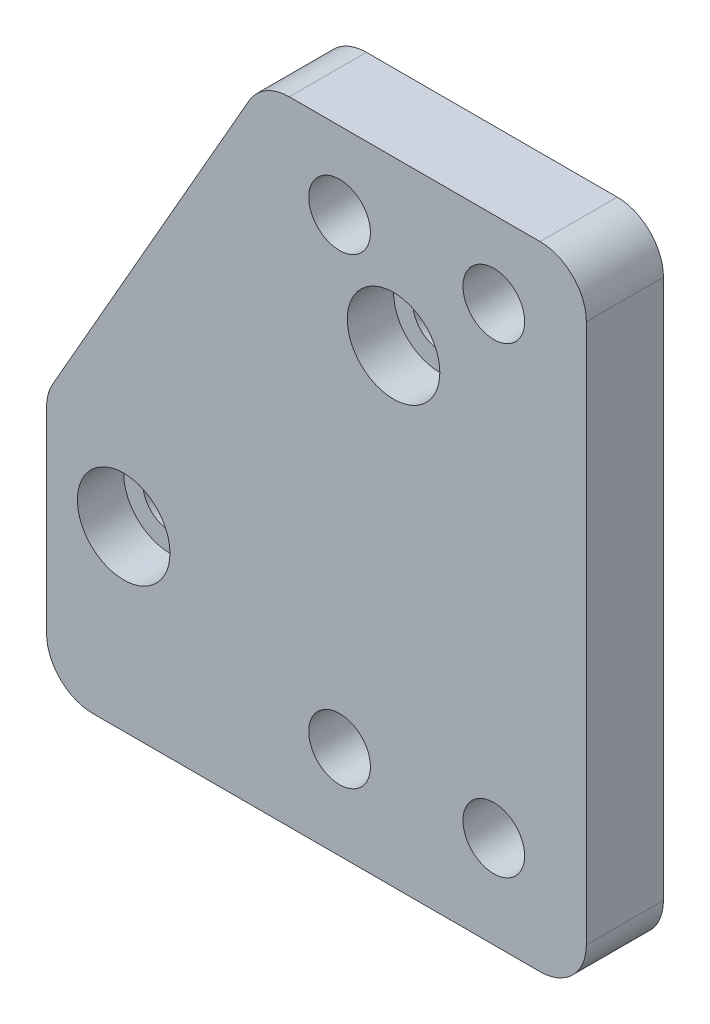
from build123d import *

# Parameters (mm, degrees)
SKETCH2_R           = 1.75
SKETCH2_R_2         = 2
BOSS_EXTRUDE1_DEPTH = 5
SKETCH3_R           = 3
CUT_EXTRUDE1_DEPTH  = 3
FILLET1_R           = 3


with BuildPart() as part:
    # Sketch2 → Boss-Extrude1 (new body)
    with BuildSketch(Plane.XY):
        Polygon((-24, -4.5), (-10, 20), (11, 20), (11, -21), (-24, -21), align=None)
        with Locations((-1.5, 9.4)):
            Circle(SKETCH2_R, mode=Mode.SUBTRACT)
        with Locations((-19, -9.5)):
            Circle(SKETCH2_R, mode=Mode.SUBTRACT)
        with Locations((-5, 15)):
            Circle(SKETCH2_R_2, mode=Mode.SUBTRACT)
        with Locations((-5, -15)):
            Circle(SKETCH2_R_2, mode=Mode.SUBTRACT)
        with Locations((5, 15)):
            Circle(SKETCH2_R_2, mode=Mode.SUBTRACT)
        with Locations((5, -15)):
            Circle(SKETCH2_R_2, mode=Mode.SUBTRACT)
    extrude(amount=BOSS_EXTRUDE1_DEPTH)

    # Sketch3 → Cut-Extrude1 (cut)
    with BuildSketch(Plane.XY.offset(5)):
        with Locations((-1.5, 9.4)):
            Circle(SKETCH3_R)
        with Locations((-19, -9.5)):
            Circle(SKETCH3_R)
    extrude(amount=-CUT_EXTRUDE1_DEPTH, mode=Mode.SUBTRACT)

    # Fillet1
    fillet1_edges = [part.edges().sort_by_distance(p)[0] for p in [
        (-24, -4.5, 2.5),
        (-10, 20, 2.5),
        (11, 20, 2.5),
        (11, -21, 2.5),
        (-24, -21, 2.5),
    ]]
    fillet(fillet1_edges, radius=FILLET1_R)


solid = part.part
